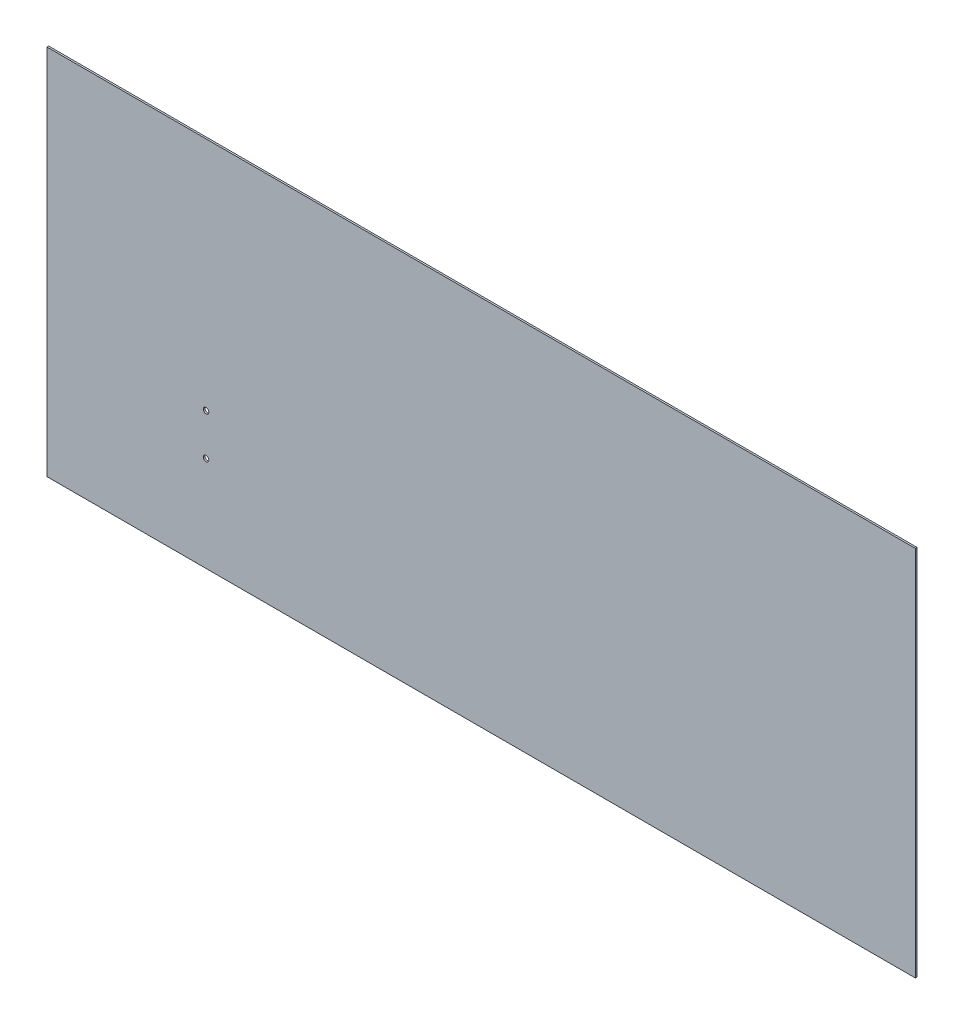
from build123d import *

# Parameters (mm, degrees)
SKETCH1_W              = 800.354
SKETCH1_H              = 342.9
BASE_FLANGE1_DEPTH     = 1.5875
F_10_CLEARANCE_HOLE2_D = 5.1054


# Sheet-metal steps are written as plain solids
with BuildPart() as part:
    # Sketch1 → Base-Flange1 (new body)
    with BuildSketch(Plane.XY):
        Rectangle(SKETCH1_W, SKETCH1_H)
    extrude(amount=-BASE_FLANGE1_DEPTH)

    # #10 Clearance Hole2 (through all)
    with Locations(Plane(origin=(0, 0, -1.5875), x_dir=(-1, 0, 0), z_dir=(0, 0, -1))):
        with Locations((253.5301, -83.626485628), (253.5301, -45.526485628)):
            Hole(F_10_CLEARANCE_HOLE2_D / 2)


solid = part.part
